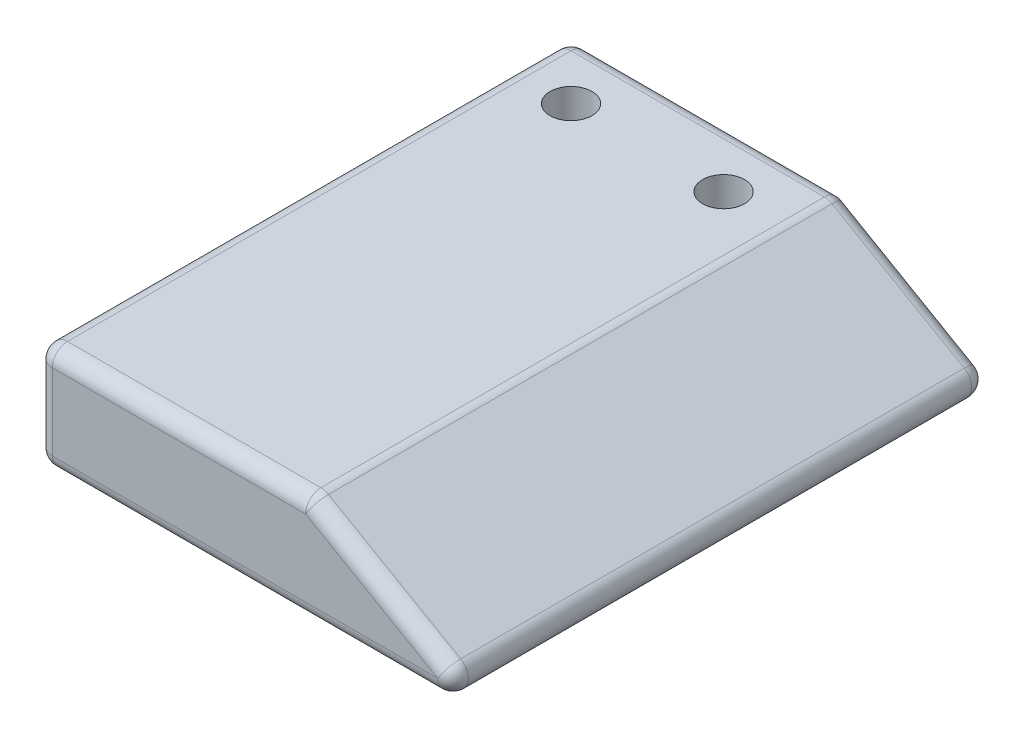
from build123d import *

# Parameters (mm, degrees)
BOSS_EXTRUDE1_DEPTH                                  = 70
CSK_FOR_M5_HEX_SOCKET_COUNTERSUNK_CAP_SC_D           = 5.5
CSK_FOR_M5_HEX_SOCKET_COUNTERSUNK_CAP_SC_CSINK_D     = 11.2
CSK_FOR_M5_HEX_SOCKET_COUNTERSUNK_CAP_SC_CSINK_ANGLE = 90
FILLET1_R                                            = 2


with BuildPart() as part:
    # Sketch1 → Boss-Extrude1 (new body)
    with BuildSketch(Plane.XY):
        Polygon((0, 0), (0, 14), (35.751288694, 14), (60, 0), align=None)
    extrude(amount=BOSS_EXTRUDE1_DEPTH)

    # CSK for M5 Hex Socket Countersunk Cap Screw1 (through all)
    with Locations(Plane(origin=(0, 0, 0), x_dir=(-1, 0, 0), z_dir=(0, -1, 0))):
        with Locations((-8, -8), (-28, -8)):
            CounterSinkHole(CSK_FOR_M5_HEX_SOCKET_COUNTERSUNK_CAP_SC_D / 2, CSK_FOR_M5_HEX_SOCKET_COUNTERSUNK_CAP_SC_CSINK_D / 2, counter_sink_angle=CSK_FOR_M5_HEX_SOCKET_COUNTERSUNK_CAP_SC_CSINK_ANGLE)

    # Fillet1
    fillet1_edges = [part.edges().sort_by_distance(p)[0] for p in [
        (60, 0, 35),
        (35.751288694, 14, 35),
        (47.875644347, 7, 0),
        (17.875644347, 14, 0),
        (30, 0, 0),
        (17.875644347, 14, 70),
        (47.875644347, 7, 70),
        (30, 0, 70),
        (0, 14, 35),
        (0, 7, 70),
        (0, 0, 35),
        (0, 7, 0),
    ]]
    fillet(fillet1_edges, radius=FILLET1_R)


solid = part.part
